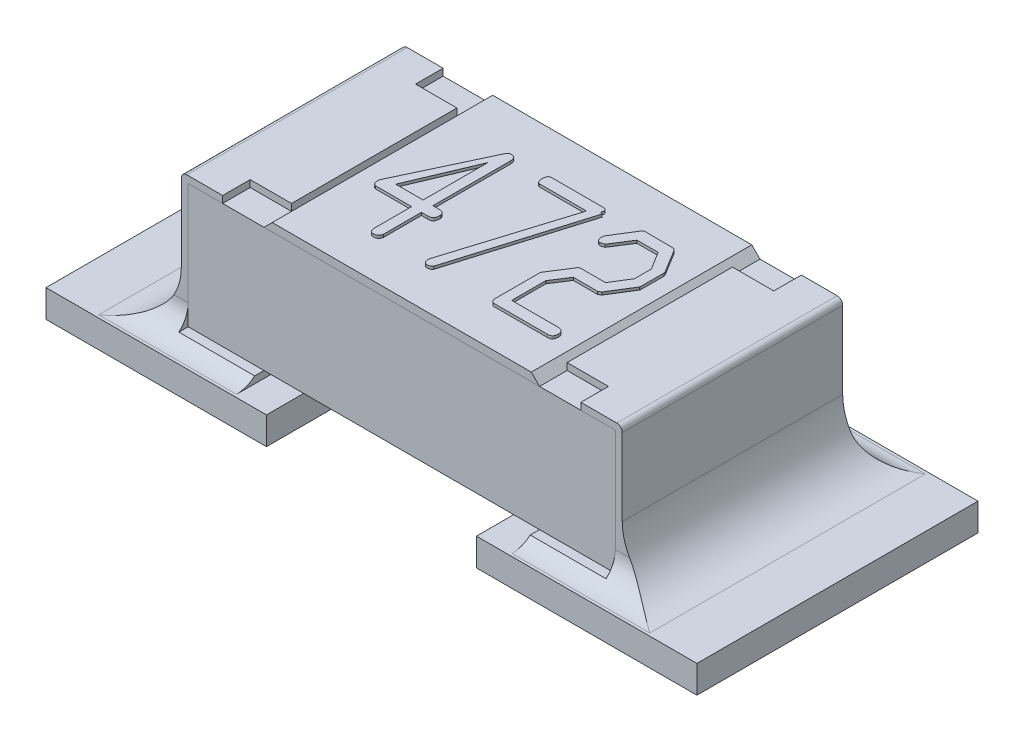
from build123d import *

# Parameters (mm, degrees)
SKETCH1_W             = 0.8
SKETCH1_H             = 0.45
BOSS_EXTRUDE1_DEPTH   = 0.775
BOSS_EXTRUDE2_DEPTH   = 0.4
BOSS_EXTRUDE2_2_DEPTH = 0.4
SKETCH3_W             = 0.15
SKETCH3_H             = 0.1
CUT_EXTRUDE1_DEPTH    = 0.025
BOSS_EXTRUDE3_DEPTH   = 0.4
BOSS_EXTRUDE4_DEPTH   = 0.01
SKETCH7_W             = 0.8
SKETCH7_H             = 1.02
BOSS_EXTRUDE5_DEPTH   = 0.1
FILLET3_R             = 0.2
FILLET4_R             = 0.2
FILLET5_R             = 0.1
FILLET6_R             = 0.1


with BuildPart() as part:
    # Sketch1 → Boss-Extrude1 (new, symmetric)
    with BuildSketch(Plane(origin=(0, 0, 0), x_dir=(0, 0, -1), z_dir=(1, 0, 0))):
        with Locations((0, 0.35)):
            Rectangle(SKETCH1_W, SKETCH1_H)
    extrude(amount=BOSS_EXTRUDE1_DEPTH, both=True)


with BuildPart() as body_2:
    # Sketch2 → Boss-Extrude2 (new, symmetric)
    with BuildSketch(Plane.XY):
        with BuildLine():
            Line((-0.5, 0.6), (-0.78, 0.6))
            ThreePointArc((-0.78, 0.6), (-0.794142136, 0.594142136), (-0.8, 0.58))
            Line((-0.8, 0.58), (-0.8, 0.1))
            Line((-0.8, 0.1), (-0.5, 0.1))
            Line((-0.5, 0.1), (-0.5, 0.125))
            Line((-0.5, 0.125), (-0.775, 0.125))
            Line((-0.775, 0.125), (-0.775, 0.575))
            Line((-0.775, 0.575), (-0.5, 0.575))
            Line((-0.5, 0.575), (-0.5, 0.6))
        make_face()
    extrude(amount=BOSS_EXTRUDE2_DEPTH, both=True)


with BuildPart() as body_3:
    # Sketch2 → Boss-Extrude2 2 (new, symmetric)
    with BuildSketch(Plane.XY):
        with BuildLine():
            Line((0.5, 0.575), (0.5, 0.6))
            Line((0.5, 0.6), (0.78, 0.6))
            ThreePointArc((0.78, 0.6), (0.794142136, 0.594142136), (0.8, 0.58))
            Line((0.8, 0.58), (0.8, 0.1))
            Line((0.8, 0.1), (0.5, 0.1))
            Line((0.5, 0.1), (0.5, 0.125))
            Line((0.5, 0.125), (0.775, 0.125))
            Line((0.775, 0.125), (0.775, 0.575))
            Line((0.775, 0.575), (0.5, 0.575))
        make_face()
    extrude(amount=BOSS_EXTRUDE2_2_DEPTH, both=True)


with BuildPart() as cut_extrude1_tool:
    # Sketch3 → Cut-Extrude1 (new body)
    with BuildSketch(Plane(origin=(0, 0.6, 0), x_dir=(1, 0, 0), z_dir=(0, 1, 0))):
        with Locations((-0.575, 0.35)):
            Rectangle(SKETCH3_W, SKETCH3_H)
        with Locations((-0.575, -0.35)):
            Rectangle(SKETCH3_W, SKETCH3_H)
        with Locations((0.575, -0.35)):
            Rectangle(SKETCH3_W, SKETCH3_H)
        with Locations((0.575, 0.35)):
            Rectangle(SKETCH3_W, SKETCH3_H)
    extrude(amount=-CUT_EXTRUDE1_DEPTH)


with BuildPart() as body_2_1:
    add(body_2.part)

    # Cut-Extrude1: cut by cut_extrude1_tool
    add(cut_extrude1_tool.part, mode=Mode.SUBTRACT)



with BuildPart() as body_3_1:
    add(body_3.part)

    # Cut-Extrude1: cut by cut_extrude1_tool
    add(cut_extrude1_tool.part, mode=Mode.SUBTRACT)


with BuildPart() as body_4:
    # Sketch4 → Boss-Extrude3 (new, symmetric)
    with BuildSketch(Plane.XY):
        Polygon((-0.5, 0.575), (0.5, 0.575), (0.47, 0.605), (-0.47, 0.605), align=None)
    extrude(amount=BOSS_EXTRUDE3_DEPTH, both=True)

    # Sketch6 → Boss-Extrude4 (add)
    # profile 1 of 3: a face of its own
    with BuildSketch(Plane(origin=(0, 0.605, 0), x_dir=(1, 0, 0), z_dir=(0, 1, 0))):
        with BuildLine():
            add(Edge.make_bspline(
                [(-0.225520833, 0.231584821), (-0.224328843, 0.229179471), (-0.221763869, 0.224003537), (-0.221545474, 0.218219081), (-0.221428571, 0.215122768)],
                knots=[0, 0, 0, 0, 0.929436375, 2, 2, 2, 2], degree=3))
            Line((-0.221428571, 0.215122768), (-0.221428571, -0.06547619))
            Line((-0.221428571, -0.06547619), (-0.191666667, -0.065755208))
            add(Edge.make_bspline(
                [(-0.191666667, -0.065755208), (-0.189759974, -0.066569361), (-0.186164235, -0.068104733), (-0.181752286, -0.071580445), (-0.178706889, -0.075897423), (-0.177924926, -0.079168923), (-0.177529762, -0.080822173)],
                knots=[0, 0, 0, 0, 1.142407476, 2.154411037, 3.067333226, 4, 4, 4, 4], degree=3))
            add(Edge.make_bspline(
                [(-0.177529762, -0.080822173), (-0.177666035, -0.083985591), (-0.177930002, -0.090113229), (-0.179368961, -0.097614697), (-0.182380665, -0.102808902), (-0.186491865, -0.105526191), (-0.192113946, -0.106847003), (-0.196310345, -0.107037182), (-0.198642113, -0.107142857)],
                knots=[0, 0, 0, 0, 1.435891738, 2.781365547, 3.412579959, 4.098311849, 4.94330951, 6, 6, 6, 6], degree=3))
            Line((-0.198642113, -0.107142857), (-0.221428571, -0.107142857))
            Line((-0.221428571, -0.107142857), (-0.221428571, -0.245442708))
            add(Edge.make_bspline(
                [(-0.221428571, -0.245442708), (-0.222123954, -0.247908921), (-0.223439832, -0.252575759), (-0.228101498, -0.258188209), (-0.234699391, -0.261468337), (-0.23961811, -0.261752191), (-0.242261905, -0.261904762)],
                knots=[0, 0, 0, 0, 1.048215258, 1.983547722, 2.916163864, 4, 4, 4, 4], degree=3))
            add(Edge.make_bspline(
                [(-0.242261905, -0.261904762), (-0.243416448, -0.261830426), (-0.245650132, -0.261686608), (-0.248768831, -0.260668827), (-0.251457391, -0.258889657), (-0.253564194, -0.256349289), (-0.255159634, -0.253120809), (-0.256376812, -0.249302993), (-0.2569555, -0.244746226), (-0.257077461, -0.241506495), (-0.257142857, -0.239769345)],
                knots=[0, 0, 0, 0, 0.91709193, 1.774288985, 2.573943089, 3.447977046, 4.36274848, 5.42267034, 6.618030972, 8, 8, 8, 8], degree=3))
            Line((-0.257142857, -0.239769345), (-0.257142857, -0.107142857))
            Line((-0.257142857, -0.107142857), (-0.387630208, -0.107142857))
            add(Edge.make_bspline(
                [(-0.387630208, -0.107142857), (-0.389514222, -0.106585638), (-0.393213233, -0.105491611), (-0.397415871, -0.100993183), (-0.399732494, -0.094697203), (-0.399904573, -0.089959751), (-0.4, -0.087332589)],
                knots=[0, 0, 0, 0, 0.908666959, 1.784046747, 2.771139651, 4, 4, 4, 4], degree=3))
            add(Edge.make_bspline(
                [(-0.4, -0.087332589), (-0.399968851, -0.085934841), (-0.399910512, -0.083317001), (-0.399527478, -0.080727141), (-0.399348958, -0.079520089)],
                knots=[0, 0, 0, 0, 1.067863558, 2, 2, 2, 2], degree=3))
            Line((-0.399348958, -0.079520089), (-0.382049851, -0.043247768))
            Line((-0.382049851, -0.043247768), (-0.25249256, 0.232607887))
            add(Edge.make_bspline(
                [(-0.25249256, 0.232607887), (-0.251787846, 0.233456226), (-0.250436848, 0.235082567), (-0.247811479, 0.23678913), (-0.244978035, 0.237865851), (-0.242984333, 0.238018541), (-0.241982887, 0.238095238)],
                knots=[0, 0, 0, 0, 1.071940796, 2.055007124, 3.023020829, 4, 4, 4, 4], degree=3))
            add(Edge.make_bspline(
                [(-0.241982887, 0.238095238), (-0.240083527, 0.238043967), (-0.236579001, 0.237949366), (-0.231827111, 0.236785863), (-0.227992875, 0.234712855), (-0.226331039, 0.232610027), (-0.225520833, 0.231584821)],
                knots=[0, 0, 0, 0, 1.232010731, 2.273194115, 3.158119099, 4, 4, 4, 4], degree=3))
        make_face()
        Polygon((-0.35656622, -0.06547619), (-0.257142857, -0.06547619), (-0.257142857, 0.169735863), align=None, mode=Mode.SUBTRACT)
    # profile 2 of 3: a face of its own
    with BuildSketch(Plane(origin=(0, 0.605, 0), x_dir=(1, 0, 0), z_dir=(0, 1, 0))):
        with BuildLine():
            add(Edge.make_bspline(
                [(0.10297619, 0.218191964), (0.103130717, 0.218268153), (0.103802548, 0.218599398), (0.105436713, 0.217493628), (0.108015859, 0.216410371), (0.110106525, 0.215193553), (0.111346726, 0.214471726)],
                knots=[0, 0, 0, 0, 0.214615259, 0.933076392, 2.180674295, 4, 4, 4, 4], degree=3))
            Line((0.111346726, 0.214471726), (-0.029743304, -0.253720238))
            add(Edge.make_bspline(
                [(-0.029743304, -0.253720238), (-0.030672822, -0.254959085), (-0.032531293, -0.257436025), (-0.036493564, -0.260091341), (-0.041265285, -0.261593399), (-0.04467471, -0.2617968), (-0.046484375, -0.261904762)],
                knots=[0, 0, 0, 0, 0.949960296, 1.89934305, 2.885006502, 4, 4, 4, 4], degree=3))
            add(Edge.make_bspline(
                [(-0.046484375, -0.261904762), (-0.047794369, -0.261806518), (-0.050289812, -0.261619371), (-0.053782678, -0.260452169), (-0.056553898, -0.258171398), (-0.057704883, -0.256152443), (-0.058296131, -0.255115327)],
                knots=[0, 0, 0, 0, 1.090943418, 2.07816779, 3.012775628, 4, 4, 4, 4], degree=3))
            add(Edge.make_bspline(
                [(-0.058296131, -0.255115327), (-0.059121944, -0.253659601), (-0.061056309, -0.250249739), (-0.061134504, -0.246307087), (-0.061179315, -0.244047619)],
                knots=[0, 0, 0, 0, 0.853833426, 2, 2, 2, 2], degree=3))
            add(Edge.make_bspline(
                [(-0.061179315, -0.244047619), (-0.061132614, -0.242992203), (-0.06103897, -0.240875925), (-0.060760748, -0.238775919), (-0.06062128, -0.237723214)],
                knots=[0, 0, 0, 0, 0.997427084, 2, 2, 2, 2], degree=3))
            Line((-0.06062128, -0.237723214), (0.073958333, 0.196428571))
            Line((0.073958333, 0.196428571), (-0.098102679, 0.196428571))
            add(Edge.make_bspline(
                [(-0.098102679, 0.196428571), (-0.099548133, 0.19723315), (-0.102441902, 0.1988439), (-0.105439707, 0.203142768), (-0.107672396, 0.208350169), (-0.108102676, 0.21233539), (-0.108333333, 0.214471726)],
                knots=[0, 0, 0, 0, 0.900814757, 1.803411863, 2.822487136, 4, 4, 4, 4], degree=3))
            add(Edge.make_bspline(
                [(-0.108333333, 0.214471726), (-0.108214979, 0.217453999), (-0.107992231, 0.223066733), (-0.106450359, 0.229796635), (-0.103969217, 0.234211872), (-0.101104313, 0.236563176), (-0.097366091, 0.237861346), (-0.094640993, 0.238013366), (-0.093173363, 0.238095238)],
                knots=[0, 0, 0, 0, 1.673282074, 3.149171549, 3.819972695, 4.474354735, 5.178347784, 6, 6, 6, 6], degree=3))
            Line((-0.093173363, 0.238095238), (-0.088709077, 0.238095238))
            Line((-0.088709077, 0.238095238), (0.090792411, 0.238095238))
            add(Edge.make_bspline(
                [(0.090792411, 0.238095238), (0.092410924, 0.238064639), (0.095340801, 0.238009249), (0.099309407, 0.237083285), (0.102405484, 0.23555882), (0.10457116, 0.23321435), (0.105700745, 0.230226728), (0.105681488, 0.22663994), (0.104798087, 0.222543363), (0.103617784, 0.21972434), (0.10297619, 0.218191964)],
                knots=[0, 0, 0, 0, 1.265296871, 2.290475389, 3.170712957, 3.927290427, 4.734801854, 5.609659769, 6.700649056, 8, 8, 8, 8], degree=3))
        make_face()
    # profile 3 of 3: a face of its own
    with BuildSketch(Plane(origin=(0, 0.605, 0), x_dir=(1, 0, 0), z_dir=(0, 1, 0))):
        with BuildLine():
            Line((0.357998512, 0.229352679), (0.40859375, 0.146391369))
            Line((0.40859375, 0.146391369), (0.40952381, 0.139508929))
            Line((0.40952381, 0.139508929), (0.409337798, 0.058314732))
            Line((0.409337798, 0.058314732), (0.408407738, 0.053571429))
            Line((0.408407738, 0.053571429), (0.356045387, -0.03031994))
            Line((0.356045387, -0.03031994), (0.346465774, -0.035714286))
            Line((0.346465774, -0.035714286), (0.258110119, -0.035714286))
            Line((0.258110119, -0.035714286), (0.219047619, -0.096261161))
            Line((0.219047619, -0.096261161), (0.219047619, -0.220238095))
            Line((0.219047619, -0.220238095), (0.392224702, -0.220331101))
            add(Edge.make_bspline(
                [(0.392224702, -0.220331101), (0.39360103, -0.220662789), (0.396193872, -0.221287651), (0.399753399, -0.222811651), (0.402779403, -0.224789618), (0.405314708, -0.227188157), (0.40724566, -0.230085235), (0.408500861, -0.233398496), (0.409395534, -0.237087711), (0.409479692, -0.239701301), (0.40952381, -0.241071429)],
                knots=[0, 0, 0, 0, 1.141760451, 2.150943647, 3.109156828, 4.047542763, 4.950183655, 5.893897588, 6.895913421, 8, 8, 8, 8], degree=3))
            add(Edge.make_bspline(
                [(0.40952381, -0.241071429), (0.409332165, -0.243247204), (0.408924537, -0.247875093), (0.407426126, -0.253690444), (0.404537693, -0.258178424), (0.400382386, -0.260383666), (0.394949297, -0.26172574), (0.390810569, -0.261840704), (0.388504464, -0.261904762)],
                knots=[0, 0, 0, 0, 1.138726456, 2.422079278, 3.094711191, 3.848644567, 4.801261795, 6, 6, 6, 6], degree=3))
            Line((0.388504464, -0.261904762), (0.19281994, -0.261904762))
            add(Edge.make_bspline(
                [(0.19281994, -0.261904762), (0.191629529, -0.261053646), (0.189307525, -0.259393469), (0.186587898, -0.256108169), (0.184443193, -0.252448439), (0.183707054, -0.249714068), (0.183333333, -0.248325893)],
                knots=[0, 0, 0, 0, 1.029528144, 2.008186523, 2.9888032, 4, 4, 4, 4], degree=3))
            Line((0.183333333, -0.248325893), (0.183333333, -0.234281994))
            Line((0.183333333, -0.234281994), (0.183333333, -0.079892113))
            Line((0.183333333, -0.079892113), (0.236346726, 0.003162202))
            Line((0.236346726, 0.003162202), (0.241648065, 0.005952381))
            Line((0.241648065, 0.005952381), (0.33344494, 0.005952381))
            Line((0.33344494, 0.005952381), (0.373809524, 0.070591518))
            Line((0.373809524, 0.070591518), (0.373809524, 0.131789435))
            Line((0.373809524, 0.131789435), (0.33390997, 0.196428571))
            Line((0.33390997, 0.196428571), (0.256994048, 0.196428571))
            Line((0.256994048, 0.196428571), (0.212165179, 0.126116071))
            add(Edge.make_bspline(
                [(0.212165179, 0.126116071), (0.21064791, 0.125521979), (0.20784308, 0.124423738), (0.203997319, 0.122998491), (0.20076291, 0.12208131), (0.19880706, 0.121848544), (0.197935268, 0.121744792)],
                knots=[0, 0, 0, 0, 1.308892729, 2.419625561, 3.295571025, 4, 4, 4, 4], degree=3))
            add(Edge.make_bspline(
                [(0.197935268, 0.121744792), (0.196842002, 0.121818239), (0.194727907, 0.121960267), (0.191725719, 0.123013215), (0.189133553, 0.124858667), (0.186203374, 0.128390366), (0.183720975, 0.134442731), (0.183469049, 0.139729871), (0.183333333, 0.142578125)],
                knots=[0, 0, 0, 0, 0.689518444, 1.333352029, 1.979561391, 2.673786501, 4.208124146, 6, 6, 6, 6], degree=3))
            Line((0.183333333, 0.142578125), (0.184449405, 0.150297619))
            Line((0.184449405, 0.150297619), (0.236346726, 0.233630952))
            Line((0.236346726, 0.233630952), (0.242113095, 0.238095238))
            Line((0.242113095, 0.238095238), (0.351116071, 0.23735119))
            Line((0.351116071, 0.23735119), (0.357998512, 0.229352679))
        make_face()
    extrude(amount=BOSS_EXTRUDE4_DEPTH)


with BuildPart() as body_2_2:
    add(body_2_1.part)

    add(body_3_1.part)  # Boss-Extrude5 merges body 3
    # Sketch7 → Boss-Extrude5 (add)
    with BuildSketch(Plane(origin=(0, 0, 0), x_dir=(1, 0, 0), z_dir=(0, 1, 0))):
        with Locations((-0.781, 0)):
            Rectangle(SKETCH7_W, SKETCH7_H)
        with Locations((0.781, 0)):
            Rectangle(SKETCH7_W, SKETCH7_H)
    extrude(amount=BOSS_EXTRUDE5_DEPTH)

    # Fillet3
    fillet3_edges = [body_2_2.edges().sort_by_distance(p)[0] for p in [
        (-0.8, 0.1, 0),
    ]]
    fillet(fillet3_edges, radius=FILLET3_R)

    # Fillet4
    fillet4_edges = [body_2_2.edges().sort_by_distance(p)[0] for p in [
        (0.8, 0.1, 0),
    ]]
    fillet(fillet4_edges, radius=FILLET4_R)

    # Fillet5
    fillet5_edges = [body_2_2.edges().sort_by_distance(p)[0] for p in [
        (0.75, 0.1, 0.4),
    ]]
    fillet(fillet5_edges, radius=FILLET5_R)
    fillet5_2_edges = [body_2_2.edges().sort_by_distance(p)[0] for p in [
        (0.75, 0.1, -0.4),
    ]]
    fillet(fillet5_2_edges, radius=FILLET5_R)

    # Fillet6
    fillet6_edges = [body_2_2.edges().sort_by_distance(p)[0] for p in [
        (-0.75, 0.1, -0.4),
    ]]
    fillet(fillet6_edges, radius=FILLET6_R)
    fillet6_2_edges = [body_2_2.edges().sort_by_distance(p)[0] for p in [
        (-0.75, 0.1, 0.4),
    ]]
    fillet(fillet6_2_edges, radius=FILLET6_R)


solid = Compound([part.part, body_4.part, body_2_2.part])
